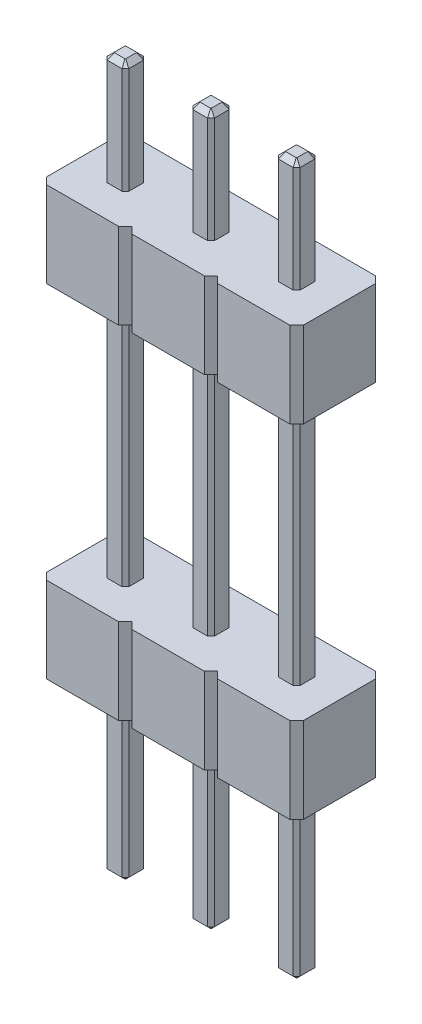
from build123d import *

# Parameters (mm, degrees)
EXTRUDE_1_DEPTH   = 5.08
EXTRUDE_1_2_DEPTH = 5.08
EXTRUDE_1_3_DEPTH = 5.08
EXTRUDE_2_DEPTH   = 16
EXTRUDE_3_DEPTH   = 2.54
EXTRUDE_START     = 12.7
EXTRUDE_4_DEPTH   = 2.54
CHAMFER_1_SIZE    = 0.15


with BuildPart() as part:
    # Эскиз1 → Бобышка-Вытянуть1 (new body)
    with BuildSketch(Plane(origin=(0, 0, 0), x_dir=(1, 0, 0), z_dir=(0, 1, 0))):
        Polygon((-1.49, 0.32), (-1.59, 0.22), (-1.59, -0.22), (-1.49, -0.32), (-1.05, -0.32), (-0.95, -0.22), (-0.95, 0.22), (-1.05, 0.32), align=None)
    extrude(amount=-EXTRUDE_1_DEPTH)



with BuildPart() as body_2:
    # Эскиз1 → Extrude 1 2 (new body)
    with BuildSketch(Plane(origin=(0, 0, 0), x_dir=(1, 0, 0), z_dir=(0, 1, 0))):
        Polygon((1.05, 0.32), (0.95, 0.22), (0.95, -0.22), (1.05, -0.32), (1.49, -0.32), (1.59, -0.22), (1.59, 0.22), (1.49, 0.32), align=None)
    extrude(amount=-EXTRUDE_1_2_DEPTH)


with BuildPart() as body_3:
    # Эскиз1 → Extrude 1 3 (new body)
    with BuildSketch(Plane(origin=(0, 0, 0), x_dir=(1, 0, 0), z_dir=(0, 1, 0))):
        Polygon((3.59, 0.32), (3.49, 0.22), (3.49, -0.22), (3.59, -0.32), (4.03, -0.32), (4.13, -0.22), (4.13, 0.22), (4.03, 0.32), align=None)
    extrude(amount=-EXTRUDE_1_3_DEPTH)


with BuildPart() as part_1:
    add(part.part)

    add(body_2.part)  # Бобышка-Вытянуть2 merges body 2

    add(body_3.part)  # Бобышка-Вытянуть2 merges body 3
    # Эскиз1<3> → Бобышка-Вытянуть2 (add)
    with BuildSketch(Plane(origin=(0, 0, 0), x_dir=(1, 0, 0), z_dir=(0, 1, 0))):
        Polygon((-1.49, 0.32), (-1.59, 0.22), (-1.59, -0.22), (-1.49, -0.32), (-1.05, -0.32), (-0.95, -0.22), (-0.95, 0.22), (-1.05, 0.32), align=None)
        Polygon((1.05, 0.32), (0.95, 0.22), (0.95, -0.22), (1.05, -0.32), (1.49, -0.32), (1.59, -0.22), (1.59, 0.22), (1.49, 0.32), align=None)
        Polygon((3.59, 0.32), (3.49, 0.22), (3.49, -0.22), (3.59, -0.32), (4.03, -0.32), (4.13, -0.22), (4.13, 0.22), (4.03, 0.32), align=None)
    extrude(amount=EXTRUDE_2_DEPTH)

    # Эскиз1<4> → Бобышка-Вытянуть3 (add)
    with BuildSketch(Plane(origin=(0, 0, 0), x_dir=(1, 0, 0), z_dir=(0, 1, 0))):
        Polygon((-0.2, 1.27), (-2.34, 1.27), (-2.54, 1.07), (-2.54, -1.07), (-2.34, -1.27), (-0.2, -1.27), (0, -1.07), (0.2, -1.27), (2.34, -1.27), (2.54, -1.07), (2.74, -1.27), (4.88, -1.27), (5.08, -1.07), (5.08, 1.07), (4.88, 1.27), (2.74, 1.27), (2.54, 1.07), (2.34, 1.27), (0.2, 1.27), (0, 1.07), align=None)
        Polygon((-1.59, -0.22), (-1.59, 0.22), (-1.49, 0.32), (-1.05, 0.32), (-0.95, 0.22), (-0.95, -0.22), (-1.05, -0.32), (-1.49, -0.32), align=None, mode=Mode.SUBTRACT)
        Polygon((0.95, 0.22), (1.05, 0.32), (1.49, 0.32), (1.59, 0.22), (1.59, -0.22), (1.49, -0.32), (1.05, -0.32), (0.95, -0.22), align=None, mode=Mode.SUBTRACT)
        Polygon((3.49, 0.22), (3.59, 0.32), (4.03, 0.32), (4.13, 0.22), (4.13, -0.22), (4.03, -0.32), (3.59, -0.32), (3.49, -0.22), align=None, mode=Mode.SUBTRACT)
    extrude(amount=EXTRUDE_3_DEPTH)

    # Эскиз1<5> → Бобышка-Вытянуть4 (add)
    with BuildSketch(Plane(origin=(0, 0, 0), x_dir=(1, 0, 0), z_dir=(0, 1, 0)).offset(EXTRUDE_START)):
        Polygon((-0.2, 1.27), (-2.34, 1.27), (-2.54, 1.07), (-2.54, -1.07), (-2.34, -1.27), (-0.2, -1.27), (0, -1.07), (0.2, -1.27), (2.34, -1.27), (2.54, -1.07), (2.74, -1.27), (4.88, -1.27), (5.08, -1.07), (5.08, 1.07), (4.88, 1.27), (2.74, 1.27), (2.54, 1.07), (2.34, 1.27), (0.2, 1.27), (0, 1.07), align=None)
        Polygon((-1.59, -0.22), (-1.59, 0.22), (-1.49, 0.32), (-1.05, 0.32), (-0.95, 0.22), (-0.95, -0.22), (-1.05, -0.32), (-1.49, -0.32), align=None, mode=Mode.SUBTRACT)
        Polygon((0.95, 0.22), (1.05, 0.32), (1.49, 0.32), (1.59, 0.22), (1.59, -0.22), (1.49, -0.32), (1.05, -0.32), (0.95, -0.22), align=None, mode=Mode.SUBTRACT)
        Polygon((3.49, 0.22), (3.59, 0.32), (4.03, 0.32), (4.13, 0.22), (4.13, -0.22), (4.03, -0.32), (3.59, -0.32), (3.49, -0.22), align=None, mode=Mode.SUBTRACT)
    extrude(amount=-EXTRUDE_4_DEPTH)

    # Фаска1
    chamfer_1_edges = [part_1.edges().sort_by_distance(p)[0] for p in [
        (-1.54, -5.08, 0.27),
        (-1.27, -5.08, 0.32),
        (-1, -5.08, 0.27),
        (-0.95, -5.08, 0),
        (-1, -5.08, -0.27),
        (-1.27, -5.08, -0.32),
        (-1.54, -5.08, -0.27),
        (-1.59, -5.08, 0),
        (1, -5.08, 0.27),
        (1.27, -5.08, 0.32),
        (1.54, -5.08, 0.27),
        (1.59, -5.08, 0),
        (1.54, -5.08, -0.27),
        (1.27, -5.08, -0.32),
        (1, -5.08, -0.27),
        (0.95, -5.08, 0),
        (1, 16, -0.27),
        (1.27, 16, -0.32),
        (1.54, 16, -0.27),
        (1.59, 16, 0),
        (1.54, 16, 0.27),
        (1.27, 16, 0.32),
        (1, 16, 0.27),
        (0.95, 16, 0),
        (-1.54, 16, -0.27),
        (-1.27, 16, -0.32),
        (-1, 16, -0.27),
        (-0.95, 16, 0),
        (-1, 16, 0.27),
        (-1.27, 16, 0.32),
        (-1.54, 16, 0.27),
        (-1.59, 16, 0),
        (3.54, 16, -0.27),
        (3.81, 16, -0.32),
        (4.08, 16, -0.27),
        (4.13, 16, 0),
        (4.08, 16, 0.27),
        (3.81, 16, 0.32),
        (3.54, 16, 0.27),
        (3.49, 16, 0),
        (3.54, -5.08, 0.27),
        (3.81, -5.08, 0.32),
        (4.08, -5.08, 0.27),
        (4.13, -5.08, 0),
        (4.08, -5.08, -0.27),
        (3.81, -5.08, -0.32),
        (3.54, -5.08, -0.27),
        (3.49, -5.08, 0),
    ]]
    chamfer(chamfer_1_edges, length=CHAMFER_1_SIZE)


solid = part_1.part
